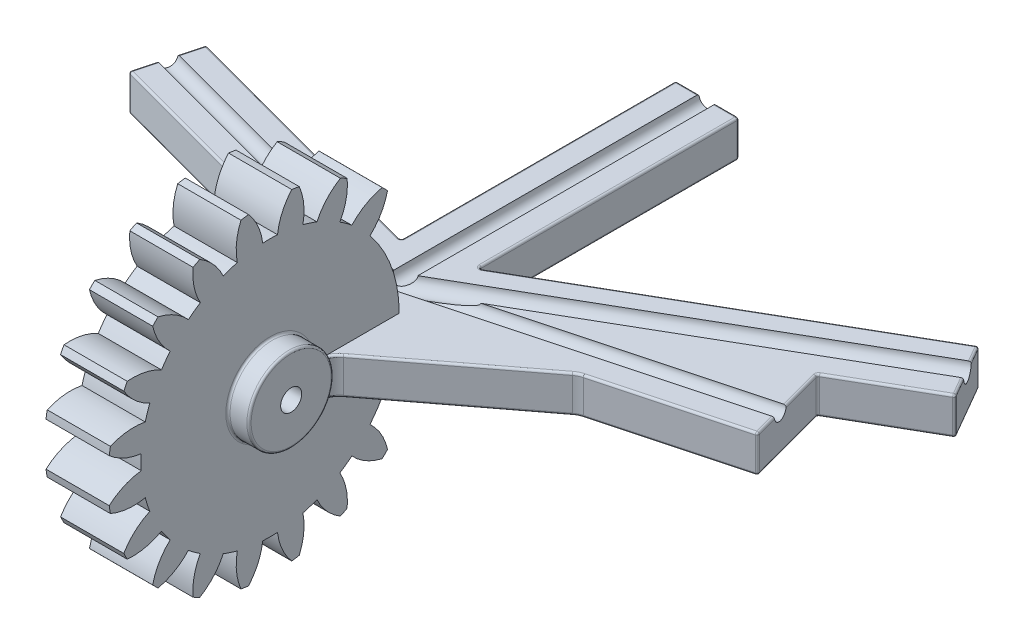
from build123d import *

# Parameters (mm, degrees)
BASPROSKE_W         = 3
BASPROSKE_H         = 7.7
TOOTHCUT_DEPTH      = 12.295131695
TEETHCUTS_COUNT     = 20
TEETHCUTS_ANGLE     = 342
BORSKE_R            = 0.5
BORE_DEPTH          = 50.0000508
CUT_EXTRUDE_1_DEPTH = 12.201503695
EXTRUDE_1_DEPTH     = 1.75
EXTRUDE_3_DEPTH     = 3
EXTRUDE_5_DEPTH     = 1.75
FILLET_4_R          = 0.1
FILLET_6_R          = 1
FILLET_7_R          = 1
FILLET_8_R          = 1
FILLET_9_R          = 0.1
FILLET_10_R         = 0.1
SKETCH_14_R         = 2
SKETCH_14_R_2       = 0.5
EXTRUDE_7_DEPTH     = 1
EXTRUDE_START       = 1
SKETCH_15_R         = 2
SKETCH_15_R_2       = 0.5
EXTRUDE_8_DEPTH     = 1
FILLET_11_R         = 0.1
FILLET_12_R         = 0.1
FILLET_13_R         = 0.1
SKETCH_9_R          = 0.4
CUT_EXTRUDE_2_DEPTH = 15
SKETCH_10_R         = 0.4
CUT_EXTRUDE_3_DEPTH = 15
SKETCH_16_R         = 0.5
CUT_EXTRUDE_4_DEPTH = 20
SKETCH_17_R         = 0.4
CUT_EXTRUDE_5_DEPTH = 15
FILLET_14_R         = 0.1


with BuildPart() as part:
    # BasProSke → Base-Revolve (revolve)
    with BuildSketch(Plane(origin=(0, 0, 0), x_dir=(1, 0, 0), z_dir=(0, 1, 0)), mode=Mode.PRIVATE) as base_revolve_sk:
        with Locations((1.5, 3.85)):
            Rectangle(BASPROSKE_W, BASPROSKE_H)
    revolve(base_revolve_sk.sketch.rotate(Axis((-10, 0, 0), (1, 0, 0)), 180), axis=Axis((-10, 0, 0), (1, 0, 0)))

    # TooCutSke → ToothCut (cut, through all)
    with BuildSketch(Plane(origin=(0, 0, 0), x_dir=(0, 0, -1), z_dir=(1, 0, 0))):
        with BuildLine():
            ThreePointArc((0.350524468, 6.11396014), (0, 6.124), (-0.350524468, 6.11396014))
            ThreePointArc((-0.350524468, 6.11396014), (-0.579534642, 6.937844235), (-1.04652851, 7.654187301))
            ThreePointArc((-1.04652851, 7.654187301), (0, 7.7254), (1.04652851, 7.654187301))
            ThreePointArc((1.04652851, 7.654187301), (0.579534642, 6.937844235), (0.350524468, 6.11396014))
        make_face()
    toothcut = extrude(amount=TOOTHCUT_DEPTH, mode=Mode.SUBTRACT)

    # TeethCuts: ToothCut ×20 about axis
    teethcuts_axis = Axis((-10, 0, 0), (1, 0, 0))
    for i in range(1, TEETHCUTS_COUNT):
        add(toothcut.rotate(teethcuts_axis, i * TEETHCUTS_ANGLE / (TEETHCUTS_COUNT - 1)), mode=Mode.SUBTRACT)

    # BorSke → Bore (cut, symmetric)
    with BuildSketch(Plane(origin=(0, 0, 0), x_dir=(0, 0, -1), z_dir=(1, 0, 0))):
        with Locations(Location((0, 0, 0), (0, 0, 180))):
            Circle(BORSKE_R)
    extrude(amount=BORE_DEPTH, both=True, mode=Mode.SUBTRACT)

    # 草图1 → 切除-拉伸1 (cut, through all)
    with BuildSketch(Plane(origin=(3, 0, 0), x_dir=(0, 0, -1), z_dir=(1, 0, 0))):
        with BuildLine():
            Line((4.954420074, 3.599596885), (6.32952333, 4.598667881))
            ThreePointArc((6.32952333, 4.598667881), (7.80058054, 0), (6.32952333, -4.598667881))
            Line((6.32952333, -4.598667881), (4.954420074, -3.599596885))
            ThreePointArc((4.954420074, -3.599596885), (6.124, 0), (4.954420074, 3.599596885))
        make_face()
    extrude(amount=-CUT_EXTRUDE_1_DEPTH, mode=Mode.SUBTRACT)

    # 草图3 → 凸台-拉伸1 (add)
    with BuildSketch(Plane(origin=(0, 0, 0), x_dir=(1, 0, 0), z_dir=(0, 1, 0))):
        Polygon((0, 6.093222374), (3, 6.093222374), (3, 6.094937651), (16.444767752, 9.697452313), (15.413748512, 13.545268498), (19.570508076, 15.945174751), (18.070508076, 18.543250962), (3, 9.842289068), (3, 22.244212856), (0, 22.244212856), (0, 9.199050916), (-12.600658827, 12.575387272), (-13.377115962, 9.677609793), align=None)
    extrude(amount=-EXTRUDE_1_DEPTH)

    # 草图4 → 凸台-拉伸3 (add)
    with BuildSketch(Plane.ZY):
        with BuildLine():
            Line((-6.093222374, 0), (-6.093222374, -1.75))
            Line((-6.093222374, -1.75), (-5.657265567, -2.344935458))
            ThreePointArc((-5.657265567, -2.344935458), (-5.880404131, -1.173427076), (-6.093222374, 0))
        make_face()
    extrude(amount=-EXTRUDE_3_DEPTH)

    # 草图6 → 凸台-拉伸5 (add)
    with BuildSketch(Plane(origin=(0, 0, 0), x_dir=(1, 0, 0), z_dir=(0, 1, 0))):
        Polygon((9.722383876, 7.896194982), (3, 2.778448376), (3, 6.094937651), align=None)
        Polygon((0, 2.778448376), (-6.688557981, 7.885416084), (0, 6.093222374), align=None)
    extrude(amount=-EXTRUDE_5_DEPTH)

    # 圆角4
    fillet_4_edges = [part.edges().sort_by_distance(p)[0] for p in [
        (15.929258132, 0, -11.621360405),
        (17.492128294, 0, -14.745221624),
        (18.820508076, 0, -17.244212856),
        (1.5, 0, -22.244212856),
        (-12.988887394, 0, -11.126498533),
        (-12.600658827, -0.875, -12.575387272),
        (1.5, -1.75, -22.244212856),
        (0, -0.875, -22.244212856),
        (3, -0.875, -22.244212856),
        (18.820508076, -1.75, -17.244212856),
        (18.070508076, -0.875, -18.543250962),
        (17.492128294, -1.75, -14.745221624),
        (19.570508076, -0.875, -15.945174751),
        (15.929258132, -1.75, -11.621360405),
        (15.413748512, -0.875, -13.545268498),
        (16.444767752, -0.875, -9.697452313),
        (-12.988887394, -1.75, -11.126498533),
        (-13.377115962, -0.875, -9.677609793),
    ]]
    fillet(fillet_4_edges, radius=FILLET_4_R)

    # 圆角6
    fillet_6_edges = [part.edges().sort_by_distance(p)[0] for p in [
        (9.722383876, -0.875, -7.896194982),
    ]]
    fillet(fillet_6_edges, radius=FILLET_6_R)

    # 圆角7
    fillet_7_edges = [part.edges().sort_by_distance(p)[0] for p in [
        (3, -0.875, -2.778448376),
    ]]
    fillet(fillet_7_edges, radius=FILLET_7_R)

    # 圆角8
    fillet_8_edges = [part.edges().sort_by_distance(p)[0] for p in [
        (0, -0.875, -2.778448376),
        (-6.688557981, -0.875, -7.885416084),
    ]]
    fillet(fillet_8_edges, radius=FILLET_8_R)

    # 圆角9
    # the kernel refuses this fillet: 0.1 mm, written as the material it takes off along each edge
    with BuildSketch(Plane(origin=(-13.254641475, -1.65, -9.748320472), x_dir=(-0.25881904510251724, 0, 0.9659258262890693), z_dir=(0, -1, 0))) as fillet_9_piece_1_section:
        Polygon((0, 0), (FILLET_9_R * 1.02, 0), (FILLET_9_R * 1.02, FILLET_9_R * 1.02), (0, FILLET_9_R * 1.02), align=None)
    fillet_9_piece_1 = extrude(amount=FILLET_9_R * 1.02, mode=Mode.PRIVATE)
    fillet_9_piece_1 = fillet_9_piece_1 - Plane(origin=(-13.254641475, -1.65, -9.748320472), x_dir=(0.8660254037844369, 0, -0.500000000000003), z_dir=(0, -1, 0)) * Sphere(FILLET_9_R, mode=Mode.PRIVATE)
    add(fillet_9_piece_1, mode=Mode.SUBTRACT)
    with BuildSketch(Plane(origin=(-13.254641475, -0.1, -9.748320472), x_dir=(-0.25881904510251724, 0, 0.9659258262890693), z_dir=(0, 1, 0))) as fillet_9_piece_2_section:
        Polygon((0, 0), (FILLET_9_R * 1.02, 0), (FILLET_9_R * 1.02, -FILLET_9_R * 1.02), (0, -FILLET_9_R * 1.02), align=None)
    fillet_9_piece_2 = extrude(amount=FILLET_9_R * 1.02, mode=Mode.PRIVATE)
    fillet_9_piece_2 = fillet_9_piece_2 - Plane(origin=(-13.254641475, -0.1, -9.748320472), x_dir=(0.8660254037844369, 0, -0.500000000000003), z_dir=(0, 1, 0)) * Sphere(FILLET_9_R, mode=Mode.PRIVATE)
    add(fillet_9_piece_2, mode=Mode.SUBTRACT)
    with BuildSketch(Plane(origin=(-13.280523379, -1.75, -9.651727889), x_dir=(0.2588190451025172, 0, -0.9659258262890692), z_dir=(0.9659258262890693, 0, 0.25881904510251724))) as fillet_9_piece_3:
        with BuildLine():
            CenterArc((FILLET_9_R, FILLET_9_R), FILLET_9_R, 180, 90)
            Line((0, FILLET_9_R), (0, 0))
            Line((0, 0), (FILLET_9_R, 0))
        make_face()
    extrude(amount=6.626833982, mode=Mode.SUBTRACT)
    with BuildSketch(Plane(origin=(-13.280523379, 0, -9.651727889), x_dir=(0.2588190451025172, 0, -0.9659258262890692), z_dir=(0.9659258262890693, 0, 0.25881904510251724))) as fillet_9_piece_4:
        with BuildLine():
            CenterArc((FILLET_9_R, -FILLET_9_R), FILLET_9_R, 90, 90)
            Line((0, -FILLET_9_R), (0, 0))
            Line((0, 0), (FILLET_9_R, 0))
        make_face()
    extrude(amount=6.626833982, mode=Mode.SUBTRACT)
    with BuildSketch(Plane(origin=(-0.393135816, 0, -3.078622483), x_dir=(0.6068641836157859, 0, -0.7948055502098269), z_dir=(-0.7948055502098269, 0, -0.606864183615786))) as fillet_9_piece_5:
        with BuildLine():
            CenterArc((FILLET_9_R, FILLET_9_R), FILLET_9_R, 180, 90)
            Line((0, FILLET_9_R), (0, 0))
            Line((0, 0), (FILLET_9_R, 0))
        make_face()
    extrude(amount=7.723036575, mode=Mode.SUBTRACT)
    with BuildSketch(Plane(origin=(-0.393135816, -1.75, -3.078622483), x_dir=(0.6068641836157859, 0, -0.7948055502098269), z_dir=(-0.7948055502098269, 0, -0.606864183615786))) as fillet_9_piece_6:
        with BuildLine():
            CenterArc((FILLET_9_R, -FILLET_9_R), FILLET_9_R, 90, 90)
            Line((0, -FILLET_9_R), (0, 0))
            Line((0, 0), (FILLET_9_R, 0))
        make_face()
    extrude(amount=7.723036575, mode=Mode.SUBTRACT)
    with BuildSketch(Plane(origin=(-7.138312334, 0, -6.970651219), x_dir=(0.2588190451025182, 0, -0.965925826289069), z_dir=(-0.965925826289069, 0, -0.2588190451025182))) as fillet_9_piece_7:
        with BuildLine():
            CenterArc((1 + FILLET_9_R, FILLET_9_R), FILLET_9_R, 180, 90)
            Line((1, FILLET_9_R), (1, 0))
            Line((1, 0), (1 + FILLET_9_R, 0))
        make_face()
    revolve(axis=Axis((-7.138312334, 0, -6.970651219), (0, -1, 0)), revolution_arc=22.363106768, mode=Mode.SUBTRACT)
    with BuildSketch(Plane(origin=(-7.138312334, -1.75, -6.970651219), x_dir=(0.2588190451025182, 0, -0.965925826289069), z_dir=(-0.965925826289069, 0, -0.2588190451025182))) as fillet_9_piece_8:
        with BuildLine():
            CenterArc((1 + FILLET_9_R, -FILLET_9_R), FILLET_9_R, 90, 90)
            Line((1, -FILLET_9_R), (1, 0))
            Line((1, 0), (1 + FILLET_9_R, 0))
        make_face()
    revolve(axis=Axis((-7.138312334, -1.75, -6.970651219), (0, -1, 0)), revolution_arc=22.363106768, mode=Mode.SUBTRACT)
    with BuildSketch(Plane(origin=(-1, 0, -2.283816933), x_dir=(0.6068641836157861, 0, -0.7948055502098269), z_dir=(-0.7948055502098269, 0, -0.6068641836157861))) as fillet_9_piece_9_section:
        with BuildLine():
            CenterArc((1 + FILLET_9_R, FILLET_9_R), FILLET_9_R, 180, 90)
            Line((1, FILLET_9_R), (1, 0))
            Line((1, 0), (1 + FILLET_9_R, 0))
        make_face()
    fillet_9_piece_9 = revolve(axis=Axis((-1, 0, -2.283816933), (0, -1, 0)), revolution_arc=66.962805944, mode=Mode.PRIVATE)
    fillet_9_piece_9 = split(fillet_9_piece_9, bisect_by=Plane(origin=(0, -0.016628304, -3.022660808), z_dir=(-1, 0, 0)), keep=Keep.TOP, mode=Mode.PRIVATE)
    add(fillet_9_piece_9, mode=Mode.SUBTRACT)
    with BuildSketch(Plane(origin=(-1, -1.75, -2.283816933), x_dir=(0.6068641836157861, 0, -0.7948055502098269), z_dir=(-0.7948055502098269, 0, -0.6068641836157861))) as fillet_9_piece_10_section:
        with BuildLine():
            CenterArc((1 + FILLET_9_R, -FILLET_9_R), FILLET_9_R, 90, 90)
            Line((1 + FILLET_9_R, 0), (1, 0))
            Line((1, 0), (1, -FILLET_9_R))
        make_face()
    fillet_9_piece_10 = revolve(axis=Axis((-1, -1.75, -2.283816933), (0, -1, 0)), revolution_arc=66.962805944, mode=Mode.PRIVATE)
    fillet_9_piece_10 = split(fillet_9_piece_10, bisect_by=Plane(origin=(0, -1.723986753, -2.727434684), z_dir=(-1, 0, 0)), keep=Keep.TOP, mode=Mode.PRIVATE)
    add(fillet_9_piece_10, mode=Mode.SUBTRACT)

    # 圆角10
    # the kernel refuses this fillet: 0.1 mm, written as the material it takes off along each edge
    with BuildSketch(Plane(origin=(16.322293264, -0.1, -9.768162991), x_dir=(0.25881904510251824, 0, 0.965925826289069), z_dir=(0, 1, 0))) as fillet_10_piece_1_section:
        Polygon((0, 0), (FILLET_10_R * 1.02, 0), (FILLET_10_R * 1.02, FILLET_10_R * 1.02), (0, FILLET_10_R * 1.02), align=None)
    fillet_10_piece_1 = extrude(amount=FILLET_10_R * 1.02, mode=Mode.PRIVATE)
    fillet_10_piece_1 = fillet_10_piece_1 - Plane(origin=(16.322293264, -0.1, -9.768162991), x_dir=(-0.8660254037844374, 0, -0.5000000000000022), z_dir=(0, 1, 0)) * Sphere(FILLET_10_R, mode=Mode.PRIVATE)
    add(fillet_10_piece_1, mode=Mode.SUBTRACT)
    with BuildSketch(Plane(origin=(16.322293264, -1.65, -9.768162991), x_dir=(0.25881904510251824, 0, 0.965925826289069), z_dir=(0, -1, 0))) as fillet_10_piece_2_section:
        Polygon((0, 0), (FILLET_10_R * 1.02, 0), (FILLET_10_R * 1.02, -FILLET_10_R * 1.02), (0, -FILLET_10_R * 1.02), align=None)
    fillet_10_piece_2 = extrude(amount=FILLET_10_R * 1.02, mode=Mode.PRIVATE)
    fillet_10_piece_2 = fillet_10_piece_2 - Plane(origin=(16.322293264, -1.65, -9.768162991), x_dir=(-0.8660254037844374, 0, -0.5000000000000022), z_dir=(0, -1, 0)) * Sphere(FILLET_10_R, mode=Mode.PRIVATE)
    add(fillet_10_piece_2, mode=Mode.SUBTRACT)
    with BuildSketch(Plane(origin=(9.912608856, -1.75, -7.947165612), x_dir=(-0.25881904510251824, 0, -0.965925826289069), z_dir=(0.965925826289069, 0, -0.25881904510251824))) as fillet_10_piece_3:
        with BuildLine():
            CenterArc((FILLET_10_R, FILLET_10_R), FILLET_10_R, 180, 90)
            Line((0, FILLET_10_R), (0, 0))
            Line((0, 0), (FILLET_10_R, 0))
        make_face()
    extrude(amount=6.662588511, mode=Mode.SUBTRACT)
    with BuildSketch(Plane(origin=(9.912608856, 0, -7.947165612), x_dir=(-0.25881904510251824, 0, -0.965925826289069), z_dir=(0.965925826289069, 0, -0.25881904510251824))) as fillet_10_piece_4:
        with BuildLine():
            CenterArc((FILLET_10_R, -FILLET_10_R), FILLET_10_R, 90, 90)
            Line((0, -FILLET_10_R), (0, 0))
            Line((0, 0), (FILLET_10_R, 0))
        make_face()
    extrude(amount=6.662588511, mode=Mode.SUBTRACT)
    with BuildSketch(Plane(origin=(10.171427901, 0, -6.981239785), x_dir=(-0.25881904510251985, 0, -0.9659258262890686), z_dir=(0.9659258262890686, 0, -0.25881904510251985))) as fillet_10_piece_5:
        with BuildLine():
            CenterArc((1 + FILLET_10_R, -FILLET_10_R), FILLET_10_R, 90, 90)
            Line((1, -FILLET_10_R), (1, 0))
            Line((1, 0), (1 + FILLET_10_R, 0))
        make_face()
    revolve(axis=Axis((10.171427901, 0, -6.981239785), (0, 1, 0)), revolution_arc=22.281995361, mode=Mode.SUBTRACT)
    with BuildSketch(Plane(origin=(10.171427901, -1.75, -6.981239785), x_dir=(-0.25881904510251985, 0, -0.9659258262890686), z_dir=(0.9659258262890686, 0, -0.25881904510251985))) as fillet_10_piece_6:
        with BuildLine():
            CenterArc((1 + FILLET_10_R, FILLET_10_R), FILLET_10_R, 180, 90)
            Line((1, FILLET_10_R), (1, 0))
            Line((1, 0), (1 + FILLET_10_R, 0))
        make_face()
    revolve(axis=Axis((10.171427901, -1.75, -6.981239785), (0, 1, 0)), revolution_arc=22.281995361, mode=Mode.SUBTRACT)
    with BuildSketch(Plane(origin=(9.565689501, -1.75, -7.776903653), x_dir=(-0.6057384005827819, 0, -0.7956638675090212), z_dir=(-0.7956638675090212, 0, 0.605738400582782))) as fillet_10_piece_7:
        with BuildLine():
            CenterArc((FILLET_10_R, -FILLET_10_R), FILLET_10_R, 90, 90)
            Line((0, -FILLET_10_R), (0, 0))
            Line((0, 0), (FILLET_10_R, 0))
        make_face()
    extrude(amount=7.756325445, mode=Mode.SUBTRACT)
    with BuildSketch(Plane(origin=(9.565689501, 0, -7.776903653), x_dir=(-0.6057384005827819, 0, -0.7956638675090212), z_dir=(-0.7956638675090212, 0, 0.605738400582782))) as fillet_10_piece_8:
        with BuildLine():
            CenterArc((FILLET_10_R, FILLET_10_R), FILLET_10_R, 180, 90)
            Line((0, FILLET_10_R), (0, 0))
            Line((0, 0), (FILLET_10_R, 0))
        make_face()
    extrude(amount=7.756325445, mode=Mode.SUBTRACT)
    with BuildSketch(Plane(origin=(4, 0, -2.282935616), x_dir=(-0.6057384005827823, 0, -0.795663867509021), z_dir=(0.795663867509021, 0, -0.6057384005827823))) as fillet_10_piece_9_section:
        with BuildLine():
            CenterArc((1 + FILLET_10_R, -FILLET_10_R), FILLET_10_R, 90, 90)
            Line((1, -FILLET_10_R), (1, 0))
            Line((1, 0), (1 + FILLET_10_R, 0))
        make_face()
    fillet_10_piece_9 = revolve(axis=Axis((4, 0, -2.282935616), (0, 1, 0)), revolution_arc=67.043923421, mode=Mode.PRIVATE)
    fillet_10_piece_9 = split(fillet_10_piece_9, bisect_by=Plane(origin=(3, -0.016628302, -3.02279015), z_dir=(1, 0, 0)), keep=Keep.TOP, mode=Mode.PRIVATE)
    add(fillet_10_piece_9, mode=Mode.SUBTRACT)
    with BuildSketch(Plane(origin=(4, -1.75, -2.282935616), x_dir=(-0.6057384005827823, 0, -0.795663867509021), z_dir=(0.795663867509021, 0, -0.6057384005827823))) as fillet_10_piece_10_section:
        with BuildLine():
            CenterArc((1 + FILLET_10_R, FILLET_10_R), FILLET_10_R, 180, 90)
            Line((1, FILLET_10_R), (1, 0))
            Line((1, 0), (1 + FILLET_10_R, 0))
        make_face()
    fillet_10_piece_10 = revolve(axis=Axis((4, -1.75, -2.282935616), (0, 1, 0)), revolution_arc=67.043923421, mode=Mode.PRIVATE)
    fillet_10_piece_10 = split(fillet_10_piece_10, bisect_by=Plane(origin=(3, -1.733371698, -3.02279015), z_dir=(1, 0, 0)), keep=Keep.TOP, mode=Mode.PRIVATE)
    add(fillet_10_piece_10, mode=Mode.SUBTRACT)

    # 草图14 → 凸台-拉伸7 (add)
    with BuildSketch(Plane.ZY):
        with Locations(Location((0, 0, 0), (0, 0, 180))):
            Circle(SKETCH_14_R)
        Circle(SKETCH_14_R_2, mode=Mode.SUBTRACT)
    extrude(amount=EXTRUDE_7_DEPTH)

    # 草图15 → 凸台-拉伸8 (add)
    with BuildSketch(Plane(origin=(3, 0, 0), x_dir=(0, 0, -1), z_dir=(1, 0, 0)).offset(EXTRUDE_START)):
        Circle(SKETCH_15_R)
        with Locations(Location((0, 0, 0), (0, 0, 180))):
            Circle(SKETCH_15_R_2, mode=Mode.SUBTRACT)
    extrude(amount=-EXTRUDE_8_DEPTH)

    # 圆角11
    fillet_11_edges = [part.edges().sort_by_distance(p)[0] for p in [
        (4, 0, 2),
    ]]
    fillet(fillet_11_edges, radius=FILLET_11_R)

    # 圆角12
    fillet_12_edges = [part.edges().sort_by_distance(p)[0] for p in [
        (0, 0, 2),
        (-1, 0, 2),
    ]]
    fillet(fillet_12_edges, radius=FILLET_12_R)

    # 圆角13
    fillet_13_edges = [part.edges().sort_by_distance(p)[0] for p in [
        (3, 0, 2),
    ]]
    fillet(fillet_13_edges, radius=FILLET_13_R)

    # 草图9 → 切除-拉伸2 (cut)
    with BuildSketch(Plane(origin=(0, 0, -22.244212856), x_dir=(-1, 0, 0), z_dir=(0, 0, -1))):
        with Locations((-1.5, 0)):
            Circle(SKETCH_9_R)
    extrude(amount=-CUT_EXTRUDE_2_DEPTH, mode=Mode.SUBTRACT)

    # 草图10 → 切除-拉伸3 (cut)
    with BuildSketch(Plane(origin=(-14.900421556, 0, -3.992555923), x_dir=(-0.25881904510251746, 0, 0.9659258262890692), z_dir=(-0.9659258262890692, 0, -0.25881904510251746))):
        with Locations((-7.385600857, 0)):
            Circle(SKETCH_10_R)
    extrude(amount=-CUT_EXTRUDE_3_DEPTH, mode=Mode.SUBTRACT)

    # 草图16 → 切除-拉伸4 (cut)
    with BuildSketch(Plane(origin=(21.582344258, 0, -12.460572267), x_dir=(-0.4999999999999981, 0, -0.8660254037844397), z_dir=(0.8660254037844397, 0, -0.4999999999999981))):
        with Locations((5.573672364, 0)):
            Circle(SKETCH_16_R)
    extrude(amount=-CUT_EXTRUDE_4_DEPTH, mode=Mode.SUBTRACT)

    # 草图17 → 切除-拉伸5 (cut)
    with BuildSketch(Plane(origin=(17.76754027, 0, -4.760798067), x_dir=(-0.2588190451025179, 0, -0.9659258262890691), z_dir=(0.9659258262890691, 0, -0.2588190451025179))):
        with Locations((6.610800551, 0)):
            Circle(SKETCH_17_R)
    extrude(amount=-CUT_EXTRUDE_5_DEPTH, mode=Mode.SUBTRACT)

    # 圆角14
    # the kernel refuses this fillet: 0.1 mm, written as the material it adds along each edge
    with BuildSketch(Plane(origin=(0, 0, -9.199050916), x_dir=(0, 0, -1), z_dir=(0, -1, 0))) as fillet_14_piece_1:
        with BuildLine():
            CenterArc((FILLET_14_R * 1.30322537284, -FILLET_14_R), FILLET_14_R, 90, 105)
            Line((FILLET_14_R * 0.337299546552, -FILLET_14_R * 1.2588190451), (0, 0))
            Line((0, 0), (FILLET_14_R * 1.30322537284, 0))
        make_face()
    extrude(amount=1.75)
    with BuildSketch(Plane(origin=(3, 0, -9.842289068), x_dir=(0.8660254037844408, 0, -0.499999999999996), z_dir=(0, -1, 0))) as fillet_14_piece_2:
        with BuildLine():
            CenterArc((FILLET_14_R * 1.73205080757, -FILLET_14_R), FILLET_14_R, 90, 120)
            Line((FILLET_14_R * 0.866025403784, -FILLET_14_R * 1.5), (0, 0))
            Line((0, 0), (FILLET_14_R * 1.73205080757, 0))
        make_face()
    extrude(amount=1.75)
    # the kernel refuses this fillet: 0.1 mm, written as the material it takes off along each edge
    with BuildSketch(Plane(origin=(18.033905535, -0.1, -18.406648422), x_dir=(0, 1, 0), z_dir=(-0.4999999999999984, 0, -0.8660254037844396))) as fillet_14_2_piece_1_section:
        Polygon((0, 0), (FILLET_14_R, 0), (FILLET_14_R, FILLET_14_R), (0, FILLET_14_R), align=None)
    fillet_14_2_piece_1 = extrude(amount=FILLET_14_R, mode=Mode.PRIVATE)
    fillet_14_2_piece_1 = fillet_14_2_piece_1 - Plane(origin=(18.033905535, -0.1, -18.406648422), x_dir=(-0.6123724356957956, -0.7071067811865475, 0.35355339059327184), z_dir=(-0.4999999999999984, 0, -0.8660254037844396)) * Sphere(FILLET_14_R, mode=Mode.PRIVATE)
    add(fillet_14_2_piece_1, mode=Mode.SUBTRACT)
    with BuildSketch(Plane(origin=(18.033905535, -1.65, -18.406648422), x_dir=(-0.4999999999999984, 0, -0.8660254037844396), z_dir=(0, -1, 0))) as fillet_14_2_piece_2_section:
        Polygon((0, 0), (FILLET_14_R, 0), (FILLET_14_R, FILLET_14_R), (0, FILLET_14_R), align=None)
    fillet_14_2_piece_2 = extrude(amount=FILLET_14_R, mode=Mode.PRIVATE)
    fillet_14_2_piece_2 = fillet_14_2_piece_2 - Plane(origin=(18.033905535, -1.65, -18.406648422), x_dir=(-0.2588190451025232, 0, 0.9659258262890676), z_dir=(0, -1, 0)) * Sphere(FILLET_14_R, mode=Mode.PRIVATE)
    add(fillet_14_2_piece_2, mode=Mode.SUBTRACT)
    with BuildSketch(Plane(origin=(-12.529948149, -1.65, -12.452912785), x_dir=(0.2588190451025181, 0, -0.9659258262890691), z_dir=(0, -1, 0))) as fillet_14_2_piece_3_section:
        Polygon((0, 0), (FILLET_14_R, 0), (FILLET_14_R, -FILLET_14_R), (0, -FILLET_14_R), align=None)
    fillet_14_2_piece_3 = extrude(amount=FILLET_14_R, mode=Mode.PRIVATE)
    fillet_14_2_piece_3 = fillet_14_2_piece_3 - Plane(origin=(-12.529948149, -1.65, -12.452912785), x_dir=(0.5000000000000026, 0, 0.866025403784437), z_dir=(0, -1, 0)) * Sphere(FILLET_14_R, mode=Mode.PRIVATE)
    add(fillet_14_2_piece_3, mode=Mode.SUBTRACT)
    with BuildSketch(Plane(origin=(-12.529948149, -0.1, -12.452912785), x_dir=(0, 1, 0), z_dir=(0.2588190451025181, 0, -0.9659258262890691))) as fillet_14_2_piece_4_section:
        Polygon((0, 0), (FILLET_14_R, 0), (FILLET_14_R, -FILLET_14_R), (0, -FILLET_14_R), align=None)
    fillet_14_2_piece_4 = extrude(amount=FILLET_14_R, mode=Mode.PRIVATE)
    fillet_14_2_piece_4 = fillet_14_2_piece_4 - Plane(origin=(-12.529948149, -0.1, -12.452912785), x_dir=(0.68301270189222, -0.7071067811865475, 0.18301270189221705), z_dir=(0.2588190451025181, 0, -0.9659258262890691)) * Sphere(FILLET_14_R, mode=Mode.PRIVATE)
    add(fillet_14_2_piece_4, mode=Mode.SUBTRACT)
    with BuildSketch(Plane(origin=(2.9, -0.1, -22.144212856), x_dir=(0, 1, 0), z_dir=(1, 0, 0))) as fillet_14_2_piece_5_section:
        Polygon((0, 0), (FILLET_14_R, 0), (FILLET_14_R, -FILLET_14_R), (0, -FILLET_14_R), align=None)
    fillet_14_2_piece_5 = extrude(amount=FILLET_14_R, mode=Mode.PRIVATE)
    fillet_14_2_piece_5 = fillet_14_2_piece_5 - Plane(origin=(2.9, -0.1, -22.144212856), x_dir=(0, -0.7071067811865475, 0.7071067811865475), z_dir=(1, 0, 0)) * Sphere(FILLET_14_R, mode=Mode.PRIVATE)
    add(fillet_14_2_piece_5, mode=Mode.SUBTRACT)
    with BuildSketch(Plane(origin=(0.1, -0.1, -22.144212856), x_dir=(0, 1, 0), z_dir=(-1, 0, 0))) as fillet_14_2_piece_6_section:
        Polygon((0, 0), (FILLET_14_R, 0), (FILLET_14_R, FILLET_14_R), (0, FILLET_14_R), align=None)
    fillet_14_2_piece_6 = extrude(amount=FILLET_14_R, mode=Mode.PRIVATE)
    fillet_14_2_piece_6 = fillet_14_2_piece_6 - Plane(origin=(0.1, -0.1, -22.144212856), x_dir=(0, -0.7071067811865475, 0.7071067811865475), z_dir=(-1, 0, 0)) * Sphere(FILLET_14_R, mode=Mode.PRIVATE)
    add(fillet_14_2_piece_6, mode=Mode.SUBTRACT)
    with BuildSketch(Plane(origin=(2.9, -1.65, -22.144212856), x_dir=(1, 0, 0), z_dir=(0, -1, 0))) as fillet_14_2_piece_7_section:
        Polygon((0, 0), (FILLET_14_R, 0), (FILLET_14_R, -FILLET_14_R), (0, -FILLET_14_R), align=None)
    fillet_14_2_piece_7 = extrude(amount=FILLET_14_R, mode=Mode.PRIVATE)
    fillet_14_2_piece_7 = fillet_14_2_piece_7 - Plane(origin=(2.9, -1.65, -22.144212856), x_dir=(-0.7071067811865474, 0, 0.7071067811865477), z_dir=(0, -1, 0)) * Sphere(FILLET_14_R, mode=Mode.PRIVATE)
    add(fillet_14_2_piece_7, mode=Mode.SUBTRACT)
    with BuildSketch(Plane(origin=(0.1, -1.65, -22.144212856), x_dir=(-1, 0, 0), z_dir=(0, -1, 0))) as fillet_14_2_piece_8_section:
        Polygon((0, 0), (FILLET_14_R, 0), (FILLET_14_R, FILLET_14_R), (0, FILLET_14_R), align=None)
    fillet_14_2_piece_8 = extrude(amount=FILLET_14_R, mode=Mode.PRIVATE)
    fillet_14_2_piece_8 = fillet_14_2_piece_8 - Plane(origin=(0.1, -1.65, -22.144212856), x_dir=(0.7071067811865476, 0, 0.7071067811865475), z_dir=(0, -1, 0)) * Sphere(FILLET_14_R, mode=Mode.PRIVATE)
    add(fillet_14_2_piece_8, mode=Mode.SUBTRACT)
    with BuildSketch(Plane(origin=(3, 0, -10.015494148), x_dir=(0, -1, 0), z_dir=(0, 0, -1)), Plane(origin=(3, -1.75, -10.015494148), x_dir=(-1, 0, 0), z_dir=(0, 0, -1))) as fillet_14_2_piece_9:
        with BuildLine():
            CenterArc((FILLET_14_R, FILLET_14_R), FILLET_14_R, 180, 90)
            Line((0, FILLET_14_R), (0, 0))
            Line((0, 0), (FILLET_14_R, 0))
        make_face()
    extrude(amount=12.128718708, mode=Mode.SUBTRACT)
    with BuildSketch(Plane(origin=(-0.125881905, 0, -9.23278087), x_dir=(0, -1, 0), z_dir=(-0.9659258262890691, 0, -0.2588190451025181)), Plane(origin=(-0.125881905, -1.75, -9.23278087), x_dir=(-0.258819045102518, 0, 0.9659258262890691), z_dir=(-0.9659258262890691, 0, -0.2588190451025181)), Plane(origin=(0, -1.75, -22.144212856), x_dir=(1, 0, 0), z_dir=(0, 0, 1)), Plane(origin=(0, 0, -22.144212856), x_dir=(0, -1, 0), z_dir=(0, 0, 1))) as fillet_14_2_piece_10:
        with BuildLine():
            CenterArc((FILLET_14_R, FILLET_14_R), FILLET_14_R, 180, 90)
            Line((0, FILLET_14_R), (0, 0))
            Line((0, 0), (FILLET_14_R, 0))
        make_face()
    extrude(amount=12.814839403, mode=Mode.SUBTRACT)
    with BuildSketch(Plane(origin=(17.983905535, -1.75, -18.493250962), x_dir=(0.49999999999999845, 0, 0.8660254037844396), z_dir=(-0.8660254037844396, 0, 0.4999999999999984)), Plane(origin=(17.983905535, 0, -18.493250962), x_dir=(0, -1, 0), z_dir=(-0.8660254037844396, 0, 0.4999999999999984))) as fillet_14_2_piece_11:
        with BuildLine():
            CenterArc((FILLET_14_R, FILLET_14_R), FILLET_14_R, 180, 90)
            Line((0, FILLET_14_R), (0, 0))
            Line((0, 0), (FILLET_14_R, 0))
        make_face()
    extrude(amount=17.128718708, mode=Mode.SUBTRACT)
    with BuildSketch(Plane(origin=(-0.1, 0, -9.329373453), x_dir=(1, 0, 0), z_dir=(0, 0, -1))) as fillet_14_2_piece_12:
        with BuildLine():
            CenterArc((0.1 + FILLET_14_R, FILLET_14_R), FILLET_14_R, 180, 90)
            Line((0.1, FILLET_14_R), (0.1, 0))
            Line((0.1, 0), (0.1 + FILLET_14_R, 0))
        make_face()
    revolve(axis=Axis((-0.1, 0, -9.329373453), (0, -1, 0)), revolution_arc=105, mode=Mode.SUBTRACT)
    with BuildSketch(Plane(origin=(3.1, 0, -10.015494148), x_dir=(0.500000000000004, 0, 0.8660254037844363), z_dir=(0.8660254037844363, 0, -0.500000000000004))) as fillet_14_2_piece_13:
        with BuildLine():
            CenterArc((0.1 + FILLET_14_R, FILLET_14_R), FILLET_14_R, 180, 90)
            Line((0.1, FILLET_14_R), (0.1, 0))
            Line((0.1, 0), (0.1 + FILLET_14_R, 0))
        make_face()
    revolve(axis=Axis((3.1, 0, -10.015494148), (0, -1, 0)), revolution_arc=120, mode=Mode.SUBTRACT)
    with BuildSketch(Plane(origin=(3.1, -1.75, -10.015494148), x_dir=(0.500000000000004, 0, 0.8660254037844363), z_dir=(0.8660254037844363, 0, -0.500000000000004))) as fillet_14_2_piece_14:
        with BuildLine():
            CenterArc((0.1 + FILLET_14_R, -FILLET_14_R), FILLET_14_R, 90, 90)
            Line((0.1, -FILLET_14_R), (0.1, 0))
            Line((0.1, 0), (0.1 + FILLET_14_R, 0))
        make_face()
    revolve(axis=Axis((3.1, -1.75, -10.015494148), (0, -1, 0)), revolution_arc=120, mode=Mode.SUBTRACT)
    with BuildSketch(Plane(origin=(-0.1, -1.75, -9.329373453), x_dir=(1, 0, 0), z_dir=(0, 0, -1))) as fillet_14_2_piece_15:
        with BuildLine():
            CenterArc((0.1 + FILLET_14_R, -FILLET_14_R), FILLET_14_R, 90, 90)
            Line((0.1, -FILLET_14_R), (0.1, 0))
            Line((0.1, 0), (0.1 + FILLET_14_R, 0))
        make_face()
    revolve(axis=Axis((-0.1, -1.75, -9.329373453), (0, -1, 0)), revolution_arc=105, mode=Mode.SUBTRACT)


solid = part.part
